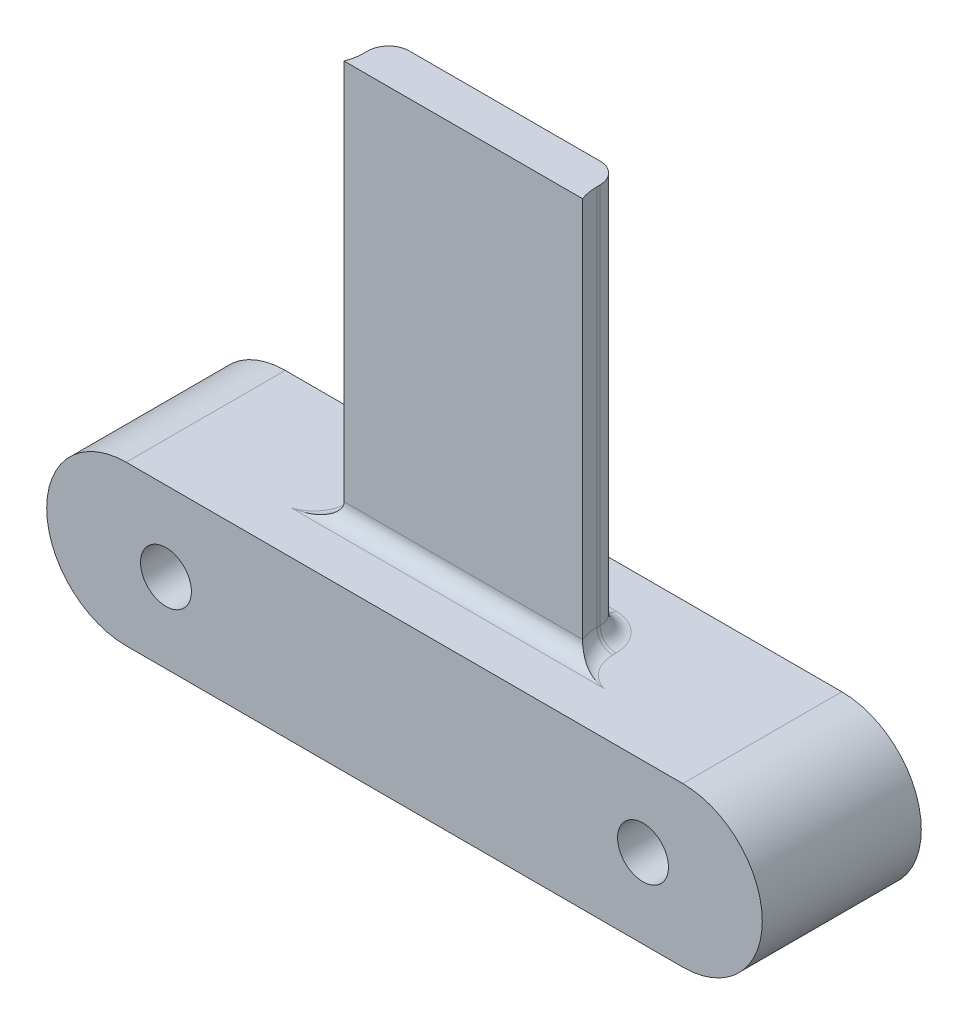
from build123d import *

# Parameters (mm, degrees)
SKETCH_1_W          = 45
SKETCH_1_H          = 10
SKETCH_1_R          = 1.6
EXTRUDE_1_DEPTH     = 5
FILLET_1_RADIUS     = 5
FILLET_1_LENGTH     = 10
FILLET_2_RADIUS     = 5
FILLET_2_LENGTH     = 10
EXTRUDE_2_DEPTH     = 25
FILLET_8_R          = 1
CUT_EXTRUDE_START   = -20
CUT_EXTRUDE_1_DEPTH = 10


with BuildPart() as part:
    # Эскиз1 → Бобышка-Вытянуть1 (new, symmetric)
    with BuildSketch(Plane.XY):
        Rectangle(SKETCH_1_W, SKETCH_1_H)
        with Locations((-15, 0)):
            Circle(SKETCH_1_R, mode=Mode.SUBTRACT)
        with Locations(Location((15, 0, 0), (0, 0, 180))):
            Circle(SKETCH_1_R, mode=Mode.SUBTRACT)
    extrude(amount=EXTRUDE_1_DEPTH, both=True)

    # Скругление1: full round fillet: the end face becomes a half cylinder, R = half its width
    fillet_1_face = Plane((-22.5, 0, 0), x_dir=(0, 0, 1), z_dir=(-1, 0, 0))  # on the end face: x along it, z out of the body
    fillet_1_slab = fillet_1_face.offset(-FILLET_1_RADIUS / 2) * Box(FILLET_1_LENGTH, 2 * FILLET_1_RADIUS, FILLET_1_RADIUS, mode=Mode.PRIVATE)  # the body's end, R deep
    fillet_1_round = Plane((-17.5, 0, 0), x_dir=(-1, 0, 0), z_dir=(0, 0, 1)) * Cylinder(FILLET_1_RADIUS, FILLET_1_LENGTH, mode=Mode.PRIVATE)  # its axis R under the face
    add(fillet_1_slab - fillet_1_round, mode=Mode.SUBTRACT)

    # Скругление2: full round fillet: the end face becomes a half cylinder, R = half its width
    fillet_2_face = Plane((22.5, 0, 0), x_dir=(0, 0, -1), z_dir=(1, 0, 0))  # on the end face: x along it, z out of the body
    fillet_2_slab = fillet_2_face.offset(-FILLET_2_RADIUS / 2) * Box(FILLET_2_LENGTH, 2 * FILLET_2_RADIUS, FILLET_2_RADIUS, mode=Mode.PRIVATE)  # the body's end, R deep
    fillet_2_round = Plane((17.5, 0, 0), x_dir=(1, 0, 0), z_dir=(0, 0, -1)) * Cylinder(FILLET_2_RADIUS, FILLET_2_LENGTH, mode=Mode.PRIVATE)  # its axis R under the face
    add(fillet_2_slab - fillet_2_round, mode=Mode.SUBTRACT)

    # Эскиз2 → Бобышка-Вытянуть2 (add)
    with BuildSketch(Plane(origin=(0, 5, 0), x_dir=(1, 0, 0), z_dir=(0, 1, 0))):
        with BuildLine():
            Line((-6, 1.3), (6, 1.3))
            ThreePointArc((6, 1.3), (6.919238816, 0.919238816), (7.3, 0))
            Line((7.3, 0), (7.3, -0.2))
            ThreePointArc((7.3, -0.2), (7.349128161, -0.758575559), (7.49500416, -1.3))
            Line((7.49500416, -1.3), (-7.49500416, -1.3))
            ThreePointArc((-7.49500416, -1.3), (-7.349128161, -0.758575559), (-7.3, -0.2))
            Line((-7.3, -0.2), (-7.3, 0))
            ThreePointArc((-7.3, 0), (-6.919238816, 0.919238816), (-6, 1.3))
        make_face()
    extrude(amount=EXTRUDE_2_DEPTH)

    # Скругление8
    fillet_8_edges = [part.edges().sort_by_distance(p)[0] for p in [
        (0, 5, 1.3),
    ]]
    fillet(fillet_8_edges, radius=FILLET_8_R)
    fillet_8_2_edges = [part.edges().sort_by_distance(p)[0] for p in [
        (-7.349128161, 5, 0.758575559),
        (7.349128161, 5, 0.758575559),
        (7.3, 5, 0.1),
        (6.919238816, 5, -0.919238816),
        (0, 5, -1.3),
        (-6.919238816, 5, -0.919238816),
        (-7.3, 5, 0.1),
    ]]
    fillet(fillet_8_2_edges, radius=FILLET_8_R - 0.0001)  # a hair under: the kernel refuses the full size

    # Эскиз3 → Вырез-Вытянуть1 (cut)
    with BuildSketch(Plane(origin=(0, 30, 0), x_dir=(1, 0, 0), z_dir=(0, 1, 0)).offset(CUT_EXTRUDE_START)):
        with BuildLine():
            Line((6.3, -0.2), (6.3, 0))
            ThreePointArc((6.3, 0), (6.212132034, 0.212132034), (6, 0.3))
            Line((6, 0.3), (-6, 0.3))
            ThreePointArc((-6, 0.3), (-6.212132034, 0.212132034), (-6.3, 0))
            Line((-6.3, 0), (-6.3, -0.2))
            ThreePointArc((-6.3, -0.2), (-6.300297672, -0.250003544), (-6.301190645, -0.3))
            Line((-6.301190645, -0.3), (6.301190645, -0.3))
            ThreePointArc((6.301190645, -0.3), (6.300297672, -0.250003544), (6.3, -0.2))
        make_face()
    extrude(amount=-CUT_EXTRUDE_1_DEPTH, mode=Mode.SUBTRACT)


solid = part.part
